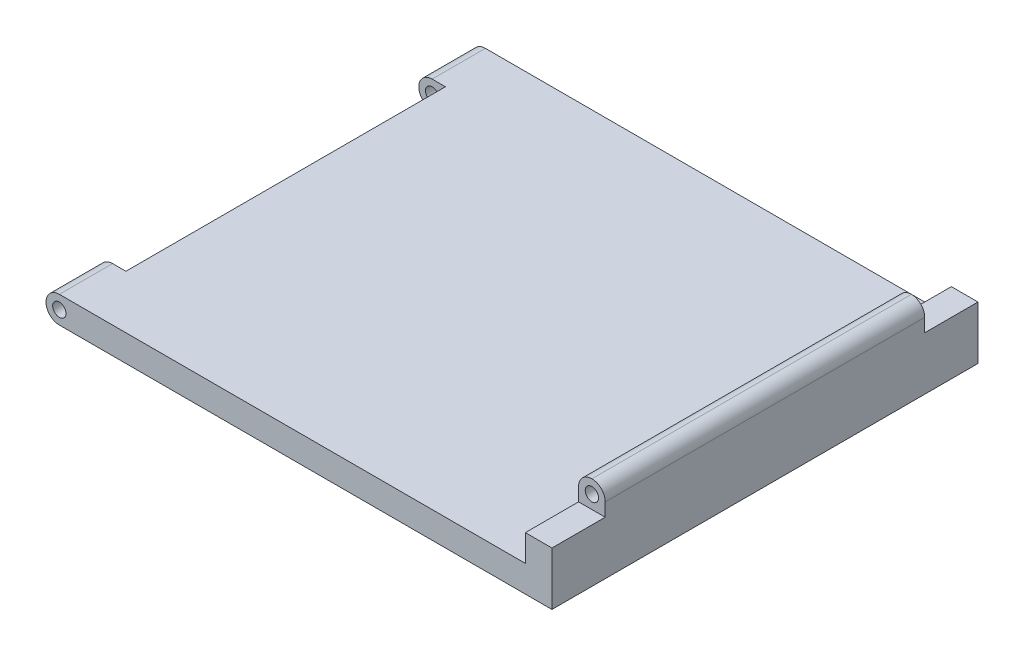
from build123d import *

# Parameters (mm, degrees)
BOSS_EXTRUDE1_DEPTH     = 40
BOSS_EXTRUDE2_START     = 30
SKETCH2_R               = 1.25
BOSS_EXTRUDE2_DEPTH     = 10
CUT_EXTRUDE1_START      = -30
SKETCH3_W               = 5
SKETCH3_H               = 5
CUT_EXTRUDE1_DEPTH      = 10
CUT_EXTRUDE2_DEPTH      = 100.624294226
CUT_EXTRUDE2_DEPTH_BACK = 100.624294226
SKETCH4_R               = 1.25
FILLET1_R               = 2.5


with BuildPart() as part:
    # Sketch1 → Boss-Extrude1 (new, symmetric)
    with BuildSketch(Plane.XY):
        Polygon((0, 0), (90, 0), (90, 15), (85, 15), (85, 5), (0, 5), align=None)
    extrude(amount=BOSS_EXTRUDE1_DEPTH, both=True)

    # Sketch2 → Boss-Extrude2 (add)
    with BuildSketch(Plane.XY.offset(BOSS_EXTRUDE2_START)):
        with BuildLine():
            Line((0, 5), (-2.5, 5))
            ThreePointArc((-2.5, 5), (-5, 2.5), (-2.5, 0))
            Line((-2.5, 0), (0, 0))
            Line((0, 0), (0, 5))
        make_face()
        with Locations((-2.5, 2.5)):
            Circle(SKETCH2_R, mode=Mode.SUBTRACT)
    boss_extrude2 = extrude(amount=BOSS_EXTRUDE2_DEPTH)

    # Mirror2: Boss-Extrude2 across plane
    add(boss_extrude2.mirror(Plane.XY))

    # Sketch3 → Cut-Extrude1 (cut)
    with BuildSketch(Plane.XY.offset(CUT_EXTRUDE1_START)):
        with Locations((87.5, 12.5)):
            Rectangle(SKETCH3_W, SKETCH3_H)
    cut_extrude1 = extrude(amount=-CUT_EXTRUDE1_DEPTH, mode=Mode.SUBTRACT)

    # Mirror3: Cut-Extrude1 across plane
    add(cut_extrude1.mirror(Plane.XY), mode=Mode.SUBTRACT)

    # Sketch4 → Cut-Extrude2 (cut, two sides: drawn at the far end of the back side and taken through both)
    with BuildSketch(Plane.XY.offset(-CUT_EXTRUDE2_DEPTH_BACK)):
        with Locations((87.5, 12.5)):
            Circle(SKETCH4_R)
    extrude(amount=CUT_EXTRUDE2_DEPTH + CUT_EXTRUDE2_DEPTH_BACK, mode=Mode.SUBTRACT)

    # Fillet1
    fillet1_edges = [part.edges().sort_by_distance(p)[0] for p in [
        (85, 15, 0),
        (90, 15, 0),
    ]]
    fillet(fillet1_edges, radius=FILLET1_R - 0.0001)  # a hair under: the kernel refuses the full size


solid = part.part
